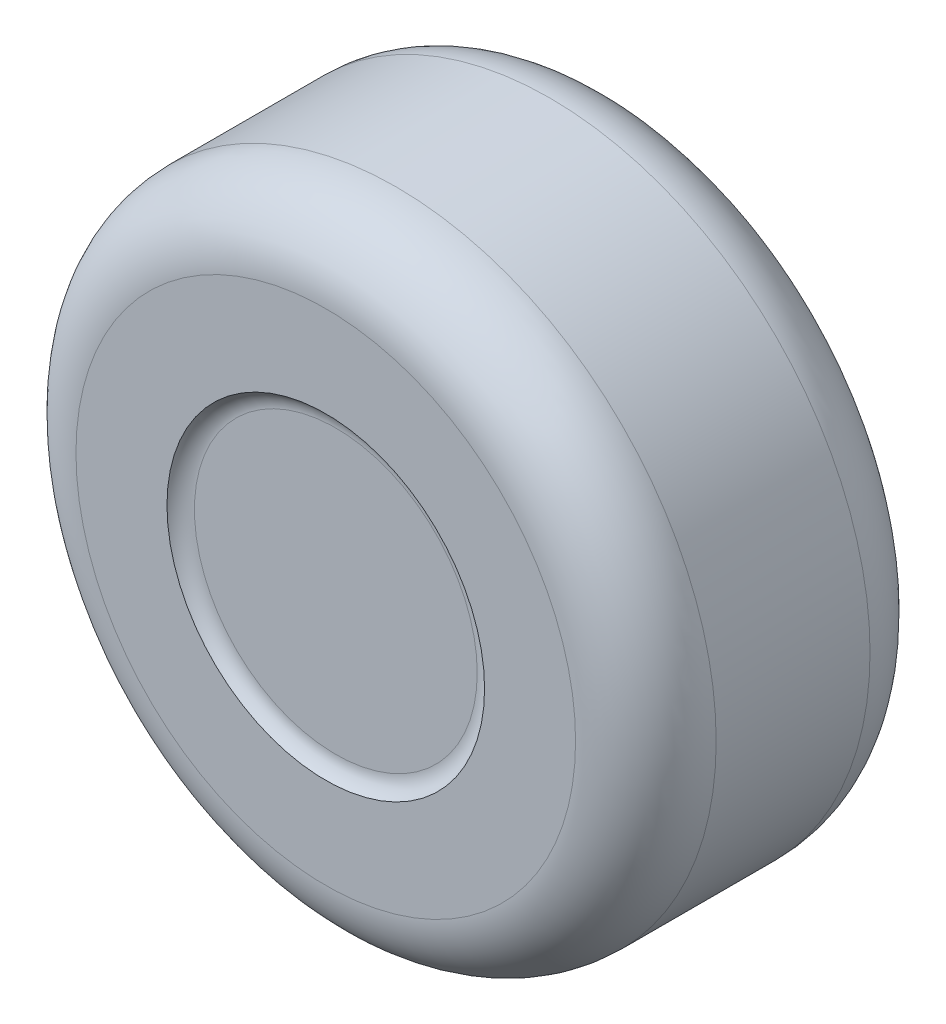
from build123d import *

# Parameters (mm, degrees)
CROQUIS1_R              = 63.75
SALIENTE_EXTRUIR1_DEPTH = 29.32
CROQUIS2_R              = 31.625
CORTAR_EXTRUIR1_DEPTH   = 2
REDONDEO2_R             = 4
REDONDEO3_R             = 14
CROQUIS4_R              = 31.625
CORTAR_EXTRUIR3_DEPTH   = 2
CROQUIS5_R              = 27.12
CORTAR_EXTRUIR4_DEPTH   = 2
REDONDEO4_R             = 14
CROQUIS6_R              = 4.05
CORTAR_EXTRUIR5_DEPTH   = 30
REDONDEO5_R             = 2
REDONDEO6_R             = 2


# Some blends are built 0.0001 mm under size
with BuildPart() as part:
    # Croquis1 → Saliente-Extruir1 (new, symmetric)
    with BuildSketch(Plane.XY):
        with Locations(Location((0, 0, 0), (0, 0, 180))):
            Circle(CROQUIS1_R)
    extrude(amount=SALIENTE_EXTRUIR1_DEPTH, both=True)

    # Croquis2 → Cortar-Extruir1 (cut)
    with BuildSketch(Plane.XY.offset(29.32)):
        Circle(CROQUIS2_R)
    extrude(amount=-CORTAR_EXTRUIR1_DEPTH, mode=Mode.SUBTRACT)

    # Redondeo2
    # the kernel refuses this fillet: 4 mm, written as the material it adds along each edge
    with BuildSketch(Plane(origin=(0, 0, 27.32), x_dir=(1, 0, 0), z_dir=(0, -1, 0))) as redondeo2_piece_1:
        with BuildLine():
            CenterArc((28.160898385, 4), REDONDEO2_R, 270, 60)
            Line((28.160898385, 0), (28.160898385, -0.08))
            Line((28.160898385, -0.08), (31.625, -0.08))
            Line((31.625, -0.08), (31.705, 0))
            ThreePointArc((31.705, 0), (31.705, 1), (31.694282032, 1.96))
            Line((31.694282032, 1.96), (31.625, 2))
        make_face()
    revolve(axis=Axis((0, 0, 27.32), (0, 0, 1)))

    # Redondeo3
    redondeo3_edges = [part.edges().sort_by_distance(p)[0] for p in [
        (63.75, 0, 29.32),
    ]]
    fillet(redondeo3_edges, radius=REDONDEO3_R)

    # Croquis4 → Cortar-Extruir3 (cut)
    with BuildSketch(Plane(origin=(0, 0, -29.32), x_dir=(-1, 0, 0), z_dir=(0, 0, -1))):
        Circle(CROQUIS4_R)
    extrude(amount=-CORTAR_EXTRUIR3_DEPTH, mode=Mode.SUBTRACT)

    # Croquis5 → Cortar-Extruir4 (cut)
    with BuildSketch(Plane(origin=(0, 0, -27.32), x_dir=(-1, 0, 0), z_dir=(0, 0, -1))):
        Circle(CROQUIS5_R)
    extrude(amount=-CORTAR_EXTRUIR4_DEPTH, mode=Mode.SUBTRACT)

    # Redondeo4
    redondeo4_edges = [part.edges().sort_by_distance(p)[0] for p in [
        (63.75, 0, -29.32),
    ]]
    fillet(redondeo4_edges, radius=REDONDEO4_R)

    # Croquis6 → Cortar-Extruir5 (cut)
    with BuildSketch(Plane(origin=(0, 0, -25.32), x_dir=(-1, 0, 0), z_dir=(0, 0, -1))):
        Circle(CROQUIS6_R)
    extrude(amount=-CORTAR_EXTRUIR5_DEPTH, mode=Mode.SUBTRACT)

    # Redondeo5
    redondeo5_edges = [part.edges().sort_by_distance(p)[0] for p in [
        (27.12, 0, -27.32),
    ]]
    fillet(redondeo5_edges, radius=REDONDEO5_R - 0.0001)  # a hair under: the kernel refuses the full size

    # Redondeo6
    redondeo6_edges = [part.edges().sort_by_distance(p)[0] for p in [
        (31.625, 0, -27.32),
    ]]
    fillet(redondeo6_edges, radius=REDONDEO6_R - 0.0001)  # a hair under: the kernel refuses the full size


solid = part.part
